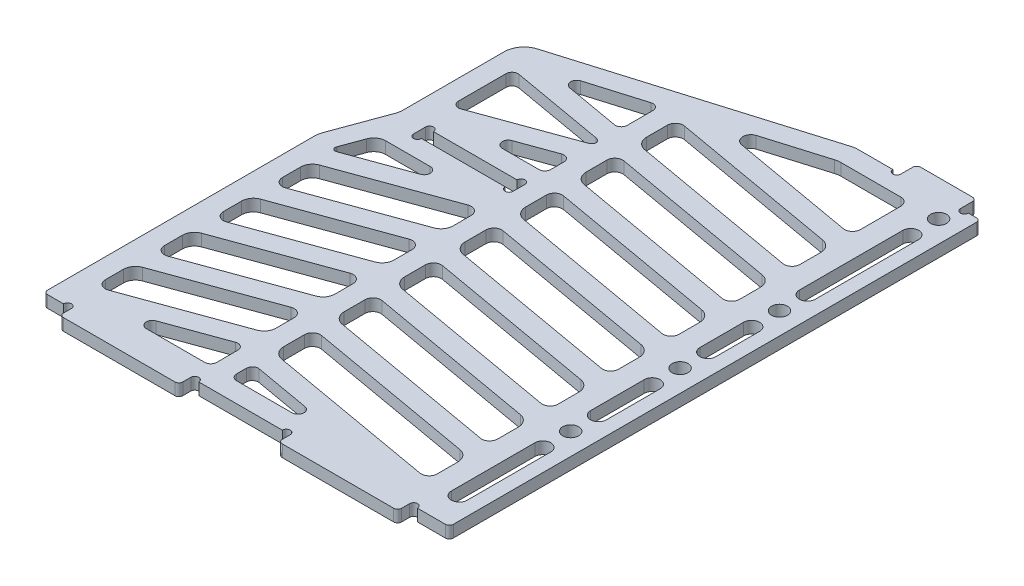
from build123d import *

# Parameters (mm, degrees)
SKETCH_1_R          = 2
SKETCH_1_W          = 25
SKETCH_1_H          = 3
EXTRUDE_1_DEPTH     = 3
CUT_EXTRUDE_2_DEPTH = 166.466764034
EXTRUDE_1_2_DEPTH   = 3
SKETCH_2_R          = 1
CUT_EXTRUDE_1_DEPTH = 166.466764034
FILLET_1_R          = 1
FILLET_2_R          = 5
FILLET_3_R          = 3
FILLET_4_R          = 1.5
FILLET_5_R          = 2
FILLET_6_R          = 0.8


with BuildPart() as part:
    # 草图1 → Extrude 1 (new body)
    with BuildSketch(Plane(origin=(0, 0, 0), x_dir=(1, 0, 0), z_dir=(0, 1, 0))):
        Polygon((0, 0), (0, -3), (-30, -3), (-30, 0), (-55, 0), (-55, -3), (-85, -3), (-85, 0), (-92, 0), (-92, 69), (-86.5, 84), (-86.5, 114), (-21.5, 133.5), (-10, 133.5), (-10, 137.5), (5, 137.5), (5, 133.5), (10, 133.5), (10, 0), align=None)
        with Locations(Location((4.5, 128.5, 0), (0, 0, 270))):
            Circle(SKETCH_1_R, mode=Mode.SUBTRACT)
        with Locations(Location((4.5, 36, 0), (0, 0, 270))):
            Circle(SKETCH_1_R, mode=Mode.SUBTRACT)
        with Locations(Location((4.5, 63.5, 0), (0, 0, 270))):
            Circle(SKETCH_1_R, mode=Mode.SUBTRACT)
        with Locations(Location((4.5, 88.5, 0), (0, 0, 270))):
            Circle(SKETCH_1_R, mode=Mode.SUBTRACT)
        with BuildLine():
            Line((6.5, 121.5), (6.5, 95.5))
            ThreePointArc((6.5, 95.5), (4.5, 93.5), (2.5, 95.5))
            Line((2.5, 95.5), (2.5, 121.5))
            ThreePointArc((2.5, 121.5), (4.5, 123.5), (6.5, 121.5))
        make_face(mode=Mode.SUBTRACT)
        with BuildLine():
            Line((6.5, 81.5), (6.5, 70.5))
            ThreePointArc((6.5, 70.5), (4.5, 68.5), (2.5, 70.5))
            Line((2.5, 70.5), (2.5, 81.5))
            ThreePointArc((2.5, 81.5), (4.5, 83.5), (6.5, 81.5))
        make_face(mode=Mode.SUBTRACT)
        with Locations((-67.5, 82.5)):
            Rectangle(SKETCH_1_W, SKETCH_1_H, mode=Mode.SUBTRACT)
        with BuildLine():
            Line((6.5, 56.5), (6.5, 43))
            ThreePointArc((6.5, 43), (4.5, 41), (2.5, 43))
            Line((2.5, 43), (2.5, 56.5))
            ThreePointArc((2.5, 56.5), (4.5, 58.5), (6.5, 56.5))
        make_face(mode=Mode.SUBTRACT)
        with BuildLine():
            Line((6.5, 29), (6.5, 8))
            ThreePointArc((6.5, 8), (4.5, 6), (2.5, 8))
            Line((2.5, 8), (2.5, 29))
            ThreePointArc((2.5, 29), (4.5, 31), (6.5, 29))
        make_face(mode=Mode.SUBTRACT)
    extrude(amount=EXTRUDE_1_DEPTH)

    # 草图3 → 切除-拉伸2 (cut, through all)
    with BuildSketch(Plane(origin=(0, 3, 0), x_dir=(1, 0, 0), z_dir=(0, 1, 0))):
        Polygon((-84.10781823, 76), (-55, 76), (-55, 5), (-87, 5), (-87, 68.112231538), align=None)
        Polygon((-81.5, 89), (-55, 89), (-55, 118.229846746), (-81.5, 110.279846746), align=None)
        Polygon((-50, 119.729846746), (-50, 5), (-3, 5), (-3, 128.5), (-20.766155818, 128.5), align=None)
    extrude(amount=-CUT_EXTRUDE_2_DEPTH, mode=Mode.SUBTRACT)

    # 草图4 → Extrude 1 2 (add)
    with BuildSketch(Plane(origin=(0, 3, 0), x_dir=(1, 0, 0), z_dir=(0, 1, 0))):
        Polygon((-52.855050358, 102.086353463), (-82.355050358, 91.349231552), (-80.644949642, 86.650768448), (-51.144949642, 97.387890359), align=None)
        Polygon((-52.855050358, 79.441142255), (-90.855050358, 65.610273353), (-89.144949642, 60.911810249), (-51.144949642, 74.742679151), align=None)
        Polygon((0.434120444, 98.169448714), (-52.565879556, 107.514778691), (-81.065879556, 112.540097641), (-83.035495062, 112.887393997), (-83.90373595, 107.963355232), (-81.934120444, 107.616058876), (-53.434120444, 102.590739926), (-0.434120444, 93.245409949), align=None)
        Polygon((0.434120444, 22.139106819), (-52.565879556, 31.484436797), (-53.434120444, 26.560398032), (-0.434120444, 17.215068054), align=None)
        Polygon((0.434120444, 113.375517093), (-52.565879556, 122.72084707), (-53.434120444, 117.796808305), (-0.434120444, 108.451478328), align=None)
        Polygon((0.434120444, 6.93303844), (-52.565879556, 16.278368418), (-53.434120444, 11.354329653), (-0.434120444, 2.008999675), align=None)
        Polygon((-52.855050358, 64.602904129), (-90.855050358, 50.772035227), (-89.144949642, 46.073572123), (-51.144949642, 59.904441025), align=None)
        Polygon((0.434120444, 82.963380335), (-52.565879556, 92.308710312), (-53.434120444, 87.384671547), (-0.434120444, 78.03934157), align=None)
        Polygon((0.434120444, 67.757311956), (-52.565879556, 77.102641934), (-53.434120444, 72.178603168), (-0.434120444, 62.833273191), align=None)
        Polygon((0.434120444, 52.551243577), (-52.565879556, 61.896573555), (-53.434120444, 56.97253479), (-0.434120444, 47.627204812), align=None)
        Polygon((0.434120444, 37.345175198), (-52.565879556, 46.690505176), (-53.434120444, 41.766466411), (-0.434120444, 32.421136433), align=None)
        Polygon((-52.855050358, 49.764666003), (-90.855050358, 35.933797101), (-89.144949642, 31.235333997), (-51.144949642, 45.066202899), align=None)
        Polygon((-52.855050358, 34.926427877), (-90.855050358, 21.095558975), (-89.144949642, 16.397095871), (-51.144949642, 30.227964773), align=None)
        Polygon((-52.855050358, 20.088189751), (-90.855050358, 6.257320849), (-89.144949642, 1.558857745), (-51.144949642, 15.389726647), align=None)
    extrude(amount=-EXTRUDE_1_2_DEPTH)

    # 草图2 → 切除-拉伸1 (cut, through all)
    with BuildSketch(Plane(origin=(0, 3, 0), x_dir=(1, 0, 0), z_dir=(0, 1, 0))):
        with Locations((-86, 0)):
            Circle(SKETCH_2_R)
        with Locations((-54, 0)):
            Circle(SKETCH_2_R)
        with Locations((-31, 0)):
            Circle(SKETCH_2_R)
        with Locations((1, 0)):
            Circle(SKETCH_2_R)
        with Locations((6, 133.5)):
            Circle(SKETCH_2_R)
        with Locations((-11, 133.5)):
            Circle(SKETCH_2_R)
        with Locations((-79, 84)):
            Circle(SKETCH_2_R)
        with Locations((-79, 81)):
            Circle(SKETCH_2_R)
        with Locations((-56, 84)):
            Circle(SKETCH_2_R)
        with Locations((-56, 81)):
            Circle(SKETCH_2_R)
    extrude(amount=-CUT_EXTRUDE_1_DEPTH, mode=Mode.SUBTRACT)

    # 圆角1
    fillet_1_edges = [part.edges().sort_by_distance(p)[0] for p in [
        (10, 1.5, 0),
        (10, 1.5, -133.5),
        (5, 1.5, -137.5),
        (-10, 1.5, -137.5),
        (-92, 1.5, 0),
        (-85, 1.5, 3),
        (-55, 1.5, 3),
        (-30, 1.5, 3),
        (0, 1.5, 3),
    ]]
    fillet(fillet_1_edges, radius=FILLET_1_R)

    # 圆角2
    fillet_2_edges = [part.edges().sort_by_distance(p)[0] for p in [
        (-21.5, 1.5, -133.5),
        (-86.5, 1.5, -114),
        (-86.5, 1.5, -84),
        (-92, 1.5, -69),
        (-20.766155818, 1.5, -128.5),
    ]]
    fillet(fillet_2_edges, radius=FILLET_2_R)

    # 圆角3
    fillet_3_edges = [part.edges().sort_by_distance(p)[0] for p in [
        (-87, 1.5, -68.112231538),
        (-84.10781823, 1.5, -76),
        (-87, 1.5, -61.692508072),
        (-87, 1.5, -32.016031821),
        (-87, 1.5, -17.177793695),
        (-87, 1.5, -46.854269946),
        (-3, 1.5, -108.903912123),
        (-3, 1.5, -93.697843744),
        (-3, 1.5, -17.667501849),
        (-3, 1.5, -78.491775365),
        (-3, 1.5, -63.285706986),
        (-3, 1.5, -48.079638607),
        (-3, 1.5, -32.873570228),
        (-50, 1.5, -31.032003002),
        (-50, 1.5, -46.238071381),
        (-50, 1.5, -61.44413976),
        (-50, 1.5, -76.650208139),
        (-50, 1.5, -15.825934623),
        (-50, 1.5, -91.856276517),
        (-50, 1.5, -107.062344896),
        (-55, 1.5, -48.983968179),
        (-55, 1.5, -19.307491928),
        (-55, 1.5, -34.145730054),
        (-55, 1.5, -63.822206305),
    ]]
    fillet(fillet_3_edges, radius=FILLET_3_R)

    # 圆角4
    # the kernel refuses this fillet: 1.5 mm, written as the material it adds along each edge
    with BuildSketch(Plane(origin=(-76.594130423, 3, -111.751607619), x_dir=(0.9578262852211524, 0, -0.2873478855663415), z_dir=(0, -1, 0))) as fillet_4_piece_1:
        with BuildLine():
            CenterArc((FILLET_4_R * 4.2139926849, FILLET_4_R), FILLET_4_R, 116.699244234, 153.300755766)
            Line((FILLET_4_R * 3.76468547043, FILLET_4_R * 1.89337731504), (FILLET_4_R * 3.75569932614, FILLET_4_R * 1.91124486134))
            Line((FILLET_4_R * 3.75569932614, FILLET_4_R * 1.91124486134), (-FILLET_4_R * 0.00898614428935, FILLET_4_R * 0.0178675463008))
            Line((-FILLET_4_R * 0.00898614428935, FILLET_4_R * 0.0178675463008), (0, -FILLET_4_R * 0.02))
            Line((0, -FILLET_4_R * 0.02), (FILLET_4_R * 4.2139926849, -FILLET_4_R * 0.02))
            Line((FILLET_4_R * 4.2139926849, -FILLET_4_R * 0.02), (FILLET_4_R * 4.2139926849, 0))
        make_face()
    extrude(amount=3)
    with BuildSketch(Plane(origin=(-55, 3, -118.229846746), x_dir=(-0.9578262852211505, 0, 0.287347885566348), z_dir=(0, -1, 0))) as fillet_4_piece_2:
        with BuildLine():
            CenterArc((FILLET_4_R * 1.34403065089, -FILLET_4_R), FILLET_4_R, 90, 106.699244234)
            Line((FILLET_4_R * 0.38620436567, -FILLET_4_R * 1.28734788557), (FILLET_4_R * 0.367047839965, -FILLET_4_R * 1.29309484328))
            Line((FILLET_4_R * 0.367047839965, -FILLET_4_R * 1.29309484328), (-FILLET_4_R * 0.0268806130178, FILLET_4_R * 0.02))
            Line((-FILLET_4_R * 0.0268806130178, FILLET_4_R * 0.02), (FILLET_4_R * 1.34403065089, FILLET_4_R * 0.02))
            Line((FILLET_4_R * 1.34403065089, FILLET_4_R * 0.02), (FILLET_4_R * 1.34403065089, 0))
        make_face()
    extrude(amount=3)
    with BuildSketch(Plane(origin=(-55, 3, -102.86684674), x_dir=(0, 0, 1), z_dir=(0, -1, 0))) as fillet_4_piece_3:
        with BuildLine():
            CenterArc((FILLET_4_R * 0.839099631177, FILLET_4_R), FILLET_4_R, 190, 80)
            Line((-FILLET_4_R * 0.145708121835, FILLET_4_R * 0.826351822333), (-FILLET_4_R * 0.165404276895, FILLET_4_R * 0.82287885878))
            Line((-FILLET_4_R * 0.165404276895, FILLET_4_R * 0.82287885878), (-FILLET_4_R * 0.0167819926235, -FILLET_4_R * 0.02))
            Line((-FILLET_4_R * 0.0167819926235, -FILLET_4_R * 0.02), (FILLET_4_R * 0.839099631177, -FILLET_4_R * 0.02))
            Line((FILLET_4_R * 0.839099631177, -FILLET_4_R * 0.02), (FILLET_4_R * 0.839099631177, 0))
        make_face()
    extrude(amount=3)
    with BuildSketch(Plane(origin=(-55, 0, -101.305655639), x_dir=(0, 0, -1), z_dir=(0, 1, 0))) as fillet_4_piece_4:
        with BuildLine():
            CenterArc((FILLET_4_R * 0.70020753821, FILLET_4_R), FILLET_4_R, 200, 70)
            Line((-FILLET_4_R * 0.239485082576, FILLET_4_R * 0.657979856674), (-FILLET_4_R * 0.258278934992, FILLET_4_R * 0.651139453808))
            Line((-FILLET_4_R * 0.258278934992, FILLET_4_R * 0.651139453808), (-FILLET_4_R * 0.0140041507642, -FILLET_4_R * 0.02))
            Line((-FILLET_4_R * 0.0140041507642, -FILLET_4_R * 0.02), (FILLET_4_R * 0.70020753821, -FILLET_4_R * 0.02))
            Line((FILLET_4_R * 0.70020753821, -FILLET_4_R * 0.02), (FILLET_4_R * 0.70020753821, 0))
        make_face()
    extrude(amount=3)
    with BuildSketch(Plane(origin=(-55, 3, -95.984766777), x_dir=(0, 0, 1), z_dir=(0, -1, 0))) as fillet_4_piece_5:
        with BuildLine():
            CenterArc((FILLET_4_R * 1.42814800674, FILLET_4_R), FILLET_4_R, 160, 110)
            Line((FILLET_4_R * 0.488455385956, FILLET_4_R * 1.34202014333), (FILLET_4_R * 0.46966153354, FILLET_4_R * 1.34886054619))
            Line((FILLET_4_R * 0.46966153354, FILLET_4_R * 1.34886054619), (-FILLET_4_R * 0.0285629601348, -FILLET_4_R * 0.02))
            Line((-FILLET_4_R * 0.0285629601348, -FILLET_4_R * 0.02), (FILLET_4_R * 1.42814800674, -FILLET_4_R * 0.02))
            Line((FILLET_4_R * 1.42814800674, -FILLET_4_R * 0.02), (FILLET_4_R * 1.42814800674, 0))
        make_face()
    extrude(amount=3)
    with BuildSketch(Plane(origin=(-55, 3, -89), x_dir=(0, 0, -1), z_dir=(0, -1, 0)), Plane(origin=(-55, 3, -5), x_dir=(0, 0, -1), z_dir=(0, -1, 0))) as fillet_4_piece_6:
        with BuildLine():
            CenterArc((FILLET_4_R, -FILLET_4_R), FILLET_4_R, 90, 90)
            Line((0, -FILLET_4_R), (-FILLET_4_R * 0.02, -FILLET_4_R))
            Line((-FILLET_4_R * 0.02, -FILLET_4_R), (-FILLET_4_R * 0.02, FILLET_4_R * 0.02))
            Line((-FILLET_4_R * 0.02, FILLET_4_R * 0.02), (FILLET_4_R, FILLET_4_R * 0.02))
            Line((FILLET_4_R, FILLET_4_R * 0.02), (FILLET_4_R, 0))
        make_face()
    extrude(amount=3)
    with BuildSketch(Plane(origin=(-55, 0, -107.9439798), x_dir=(-0.9848077530122077, 0, -0.17364817766693239), z_dir=(0, 1, 0)), Plane(origin=(-81.5, 0, -107.539511729), x_dir=(0.9848077530122056, 0, 0.1736481776669451), z_dir=(0, 1, 0))) as fillet_4_piece_7:
        with BuildLine():
            CenterArc((FILLET_4_R * 1.19175359259, -FILLET_4_R), FILLET_4_R, 90, 100)
            Line((FILLET_4_R * 0.206945839582, -FILLET_4_R * 1.17364817767), (FILLET_4_R * 0.187249684522, -FILLET_4_R * 1.17712114122))
            Line((FILLET_4_R * 0.187249684522, -FILLET_4_R * 1.17712114122), (-FILLET_4_R * 0.0238350718519, FILLET_4_R * 0.02))
            Line((-FILLET_4_R * 0.0238350718519, FILLET_4_R * 0.02), (FILLET_4_R * 1.19175359259, FILLET_4_R * 0.02))
            Line((FILLET_4_R * 1.19175359259, FILLET_4_R * 0.02), (FILLET_4_R * 1.19175359259, 0))
        make_face()
    extrude(amount=3)
    with BuildSketch(Plane(origin=(-81.5, 3, -91.660444431), x_dir=(0.9396926207859054, 0, -0.34202014332567676), z_dir=(0, -1, 0)), Plane(origin=(-55, 0, -13.986603065), x_dir=(0, 0, 1), z_dir=(0, 1, 0))) as fillet_4_piece_8:
        with BuildLine():
            CenterArc((FILLET_4_R * 1.42814800674, -FILLET_4_R), FILLET_4_R, 90, 110)
            Line((FILLET_4_R * 0.488455385956, -FILLET_4_R * 1.34202014333), (FILLET_4_R * 0.46966153354, -FILLET_4_R * 1.34886054619))
            Line((FILLET_4_R * 0.46966153354, -FILLET_4_R * 1.34886054619), (-FILLET_4_R * 0.0285629601348, FILLET_4_R * 0.02))
            Line((-FILLET_4_R * 0.0285629601348, FILLET_4_R * 0.02), (FILLET_4_R * 1.42814800674, FILLET_4_R * 0.02))
            Line((FILLET_4_R * 1.42814800674, FILLET_4_R * 0.02), (FILLET_4_R * 1.42814800674, 0))
        make_face()
    extrude(amount=3)
    with BuildSketch(Plane(origin=(-74.190489, 0, -89), x_dir=(0.9396926207859083, 0, -0.3420201433256689), z_dir=(0, 1, 0)), Plane(origin=(-79.690489, 3, -5), x_dir=(1, 0, 0), z_dir=(0, -1, 0))) as fillet_4_piece_9:
        with BuildLine():
            CenterArc((FILLET_4_R * 5.67128181962, -FILLET_4_R), FILLET_4_R, 90, 160)
            Line((FILLET_4_R * 5.32926167629, -FILLET_4_R * 1.93969262079), (FILLET_4_R * 5.32242127343, -FILLET_4_R * 1.9584864732))
            Line((FILLET_4_R * 5.32242127343, -FILLET_4_R * 1.9584864732), (-FILLET_4_R * 0.00684040286651, -FILLET_4_R * 0.0187938524157))
            Line((-FILLET_4_R * 0.00684040286651, -FILLET_4_R * 0.0187938524157), (0, FILLET_4_R * 0.02))
            Line((0, FILLET_4_R * 0.02), (FILLET_4_R * 5.67128181962, FILLET_4_R * 0.02))
            Line((FILLET_4_R * 5.67128181962, FILLET_4_R * 0.02), (FILLET_4_R * 5.67128181962, 0))
        make_face()
    extrude(amount=3)
    with BuildSketch(Plane(origin=(-50, 3, -5), x_dir=(0, 0, -1), z_dir=(0, -1, 0))) as fillet_4_piece_10:
        with BuildLine():
            CenterArc((FILLET_4_R, FILLET_4_R), FILLET_4_R, 180, 90)
            Line((0, FILLET_4_R), (-FILLET_4_R * 0.02, FILLET_4_R))
            Line((-FILLET_4_R * 0.02, FILLET_4_R), (-FILLET_4_R * 0.02, -FILLET_4_R * 0.02))
            Line((-FILLET_4_R * 0.02, -FILLET_4_R * 0.02), (FILLET_4_R, -FILLET_4_R * 0.02))
            Line((FILLET_4_R, -FILLET_4_R * 0.02), (FILLET_4_R, 0))
        make_face()
    extrude(amount=3)
    with BuildSketch(Plane(origin=(-50, 0, -10.748801564), x_dir=(0, 0, 1), z_dir=(0, 1, 0))) as fillet_4_piece_11:
        with BuildLine():
            CenterArc((FILLET_4_R * 1.19175359259, FILLET_4_R), FILLET_4_R, 170, 100)
            Line((FILLET_4_R * 0.206945839582, FILLET_4_R * 1.17364817767), (FILLET_4_R * 0.187249684522, FILLET_4_R * 1.17712114122))
            Line((FILLET_4_R * 0.187249684522, FILLET_4_R * 1.17712114122), (-FILLET_4_R * 0.0238350718519, -FILLET_4_R * 0.02))
            Line((-FILLET_4_R * 0.0238350718519, -FILLET_4_R * 0.02), (FILLET_4_R * 1.19175359259, -FILLET_4_R * 0.02))
            Line((FILLET_4_R * 1.19175359259, -FILLET_4_R * 0.02), (FILLET_4_R * 1.19175359259, 0))
        make_face()
    extrude(amount=3)
    with BuildSketch(Plane(origin=(-17.396926208, 3, -5), x_dir=(-1, 0, 0), z_dir=(0, -1, 0))) as fillet_4_piece_12:
        with BuildLine():
            CenterArc((FILLET_4_R * 11.4300523028, FILLET_4_R), FILLET_4_R, 100, 170)
            Line((FILLET_4_R * 11.2564041251, FILLET_4_R * 1.98480775301), (FILLET_4_R * 11.2529311615, FILLET_4_R * 2.00450390807))
            Line((FILLET_4_R * 11.2529311615, FILLET_4_R * 2.00450390807), (-FILLET_4_R * 0.00347296355334, FILLET_4_R * 0.0196961550602))
            Line((-FILLET_4_R * 0.00347296355334, FILLET_4_R * 0.0196961550602), (0, -FILLET_4_R * 0.02))
            Line((0, -FILLET_4_R * 0.02), (FILLET_4_R * 11.4300523028, -FILLET_4_R * 0.02))
            Line((FILLET_4_R * 11.4300523028, -FILLET_4_R * 0.02), (FILLET_4_R * 11.4300523028, 0))
        make_face()
    extrude(amount=3)
    with BuildSketch(Plane(origin=(-62.309511, 3, -76), x_dir=(-0.9396926207859084, 0, 0.3420201433256686), z_dir=(0, -1, 0))) as fillet_4_piece_13:
        with BuildLine():
            CenterArc((FILLET_4_R * 5.67128181962, FILLET_4_R), FILLET_4_R, 110, 160)
            Line((FILLET_4_R * 5.32926167629, FILLET_4_R * 1.93969262079), (FILLET_4_R * 5.32242127343, FILLET_4_R * 1.9584864732))
            Line((FILLET_4_R * 5.32242127343, FILLET_4_R * 1.9584864732), (-FILLET_4_R * 0.00684040286651, FILLET_4_R * 0.0187938524157))
            Line((-FILLET_4_R * 0.00684040286651, FILLET_4_R * 0.0187938524157), (0, -FILLET_4_R * 0.02))
            Line((0, -FILLET_4_R * 0.02), (FILLET_4_R * 5.67128181962, -FILLET_4_R * 0.02))
            Line((FILLET_4_R * 5.67128181962, -FILLET_4_R * 0.02), (FILLET_4_R * 5.67128181962, 0))
        make_face()
    extrude(amount=3)
    with BuildSketch(Plane(origin=(-87, 0, -67.013396935), x_dir=(0, 0, -1), z_dir=(0, 1, 0))) as fillet_4_piece_14:
        with BuildLine():
            CenterArc((1.867681401, -0.745705874), FILLET_4_R, 150.189217996, 49.810782004)
            Line((0.458142469, -1.258736089), (0.429951691, -1.268996694))
            Line((0.429951691, -1.268996694), (-0.028190779, -0.010260604))
            Line((-0.028190779, -0.010260604), (0, 0.03))
            ThreePointArc((0, 0.03), (0.283086763, 0.03), (0.540143368, 0.014914117))
            Line((0.540143368, 0.014914117), (0.566173525, 0))
        make_face()
    extrude(amount=3)

    # 圆角5
    fillet_5_edges = [part.edges().sort_by_distance(p)[0] for p in [
        (-3, 1.5, -22.744634909),
        (-3, 1.5, -37.950703287),
        (-3, 1.5, -53.156771666),
        (-3, 1.5, -68.362840045),
        (-3, 1.5, -128.5),
        (-3, 1.5, -113.981045182),
        (-44.670538028, 1.5, -121.328685337),
        (-3, 1.5, -7.53856653),
        (-55, 1.5, -73.339555569),
        (-55, 1.5, -43.663079317),
        (-55, 1.5, -28.824841191),
        (-3, 1.5, -83.568908424),
        (-55, 1.5, -58.501317443),
        (-50, 1.5, -117.191280216),
        (-50, 1.5, -101.985211837),
        (-3, 1.5, -98.774976803),
        (-50, 1.5, -25.954869942),
        (-50, 1.5, -86.779143458),
        (-50, 1.5, -71.573075079),
        (-50, 1.5, -56.3670067),
        (-50, 1.5, -41.160938321),
        (-87, 1.5, -37.336920683),
        (-87, 1.5, -7.660444431),
        (-87, 1.5, -22.498682557),
        (-87, 1.5, -52.175158809),
    ]]
    fillet(fillet_5_edges, radius=FILLET_5_R)

    # 圆角6
    fillet_6_edges = [part.edges().sort_by_distance(p)[0] for p in [
        (-87, 1.5, -67.57957046),
        (-55.047343765, 1.5, -101.98208212),
    ]]
    fillet(fillet_6_edges, radius=FILLET_6_R)


solid = part.part
